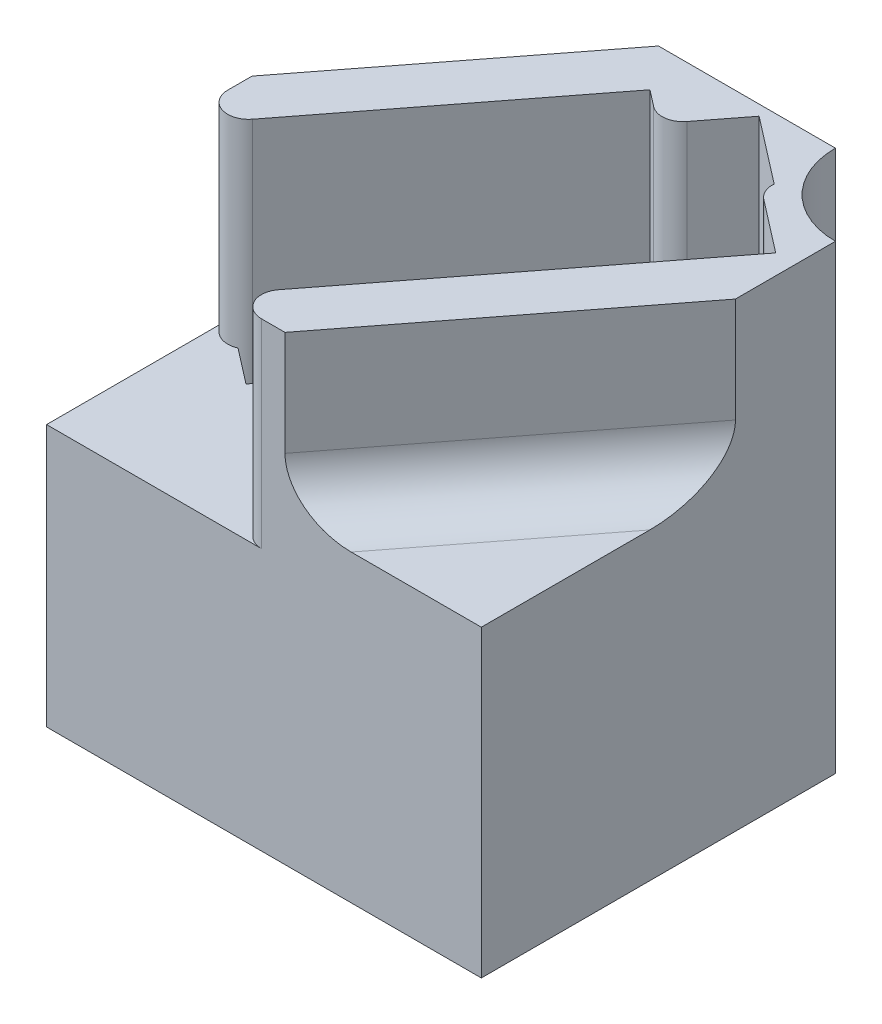
from build123d import *

# Parameters (mm, degrees)
BOSS_EXTRUDE1_DEPTH = 44
CUT_EXTRUDE1_DEPTH  = 19
CUT_EXTRUDE2_DEPTH  = 22
CUT_EXTRUDE3_DEPTH  = 19
CUT_EXTRUDE4_DEPTH  = 19
CUT_EXTRUDE5_DEPTH  = 15
FILLET1_R           = 2
FILLET2_R           = 5


with BuildPart() as part:
    # Sketch1 → Boss-Extrude1 (new body)
    with BuildSketch(Plane(origin=(0, 0, 0), x_dir=(1, 0, 0), z_dir=(0, 1, 0))):
        with BuildLine():
            Line((33.8, 41.5), (0, 41.5))
            Line((0, 41.5), (0, 0))
            Line((0, 0), (41.5, 0))
            Line((41.5, 0), (41.5, 33.8))
            ThreePointArc((41.5, 33.8), (36.055277785, 36.055277785), (33.8, 41.5))
        make_face()
    extrude(amount=BOSS_EXTRUDE1_DEPTH)

    # Sketch2 → Cut-Extrude1 (cut)
    with BuildSketch(Plane(origin=(0, 44, 0), x_dir=(1, 0, 0), z_dir=(0, 1, 0))):
        Polygon((6.330417381, 0), (0, 0), (0, 4.89140223), (27.514137546, 40.5), (33.844554927, 35.60859777), align=None)
    extrude(amount=-CUT_EXTRUDE1_DEPTH, mode=Mode.SUBTRACT)

    # Sketch3 → Cut-Extrude2 (cut)
    with BuildSketch(Plane(origin=(0, 44, 0), x_dir=(1, 0, 0), z_dir=(0, 1, 0))):
        Polygon((6.165208691, 12.870370718), (23.285116497, 35.026831552), (20.119907806, 37.472532667), (3, 15.316071833), align=None)
    extrude(amount=-CUT_EXTRUDE2_DEPTH, mode=Mode.SUBTRACT)

    # Sketch5 → Cut-Extrude3 (cut)
    with BuildSketch(Plane(origin=(0, 44, 0), x_dir=(1, 0, 0), z_dir=(0, 1, 0))):
        Polygon((11.268941532, 6.39140223), (33.280251569, 34.878280446), (39.61066895, 29.986878216), (17.599358914, 1.5), align=None)
    extrude(amount=-CUT_EXTRUDE3_DEPTH, mode=Mode.SUBTRACT)

    # Sketch6 → Cut-Extrude4 (cut)
    with BuildSketch(Plane(origin=(0, 44, 0), x_dir=(1, 0, 0), z_dir=(0, 1, 0))):
        Polygon((17.599358914, 1.5), (16.440335282, 0), (0, 0), (0, 11.433493535), (3, 15.316071833), (6.165208691, 12.870370718), (11.268941532, 6.39140223), align=None)
    extrude(amount=-CUT_EXTRUDE4_DEPTH, mode=Mode.SUBTRACT)

    # Sketch7 → Cut-Extrude5 (cut)
    with BuildSketch(Plane(origin=(0, 44, 0), x_dir=(1, 0, 0), z_dir=(0, 1, 0))):
        Polygon((22.759033969, 0), (41.5, 24.254422662), (41.5, 0), align=None)
        Polygon((0, 19.611107666), (16.913162329, 41.5), (0, 41.5), align=None)
    extrude(amount=-CUT_EXTRUDE5_DEPTH, mode=Mode.SUBTRACT)

    # Fillet1
    # the kernel refuses this fillet: 2 mm, written as the material it takes off along each edge
    with BuildSketch(Plane(origin=(33.280251569, 48.213017341, -34.878280446), x_dir=(0.7913021726593984, 0, 0.6114252787908885), z_dir=(0, -1, 0))) as fillet1_piece_1:
        with BuildLine():
            CenterArc((1.685206936, -2), FILLET1_R, 90, 57.416069246)
            Line((0, -0.922931023), (0, 0))
            Line((0, 0), (1.685206936, 0))
        make_face()
    extrude(amount=23.213017341, mode=Mode.SUBTRACT)
    with BuildSketch(Plane(origin=(23.285116497, 49, -35.026831552), x_dir=(0.6114252787908897, 0, -0.7913021726593975), z_dir=(0, -1, 0))) as fillet1_piece_2:
        with BuildLine():
            CenterArc((FILLET1_R, -FILLET1_R), FILLET1_R, 90, 90)
            Line((0, -FILLET1_R), (0, 0))
            Line((0, 0), (FILLET1_R, 0))
        make_face()
    extrude(amount=24, mode=Mode.SUBTRACT)
    with BuildSketch(Plane(origin=(16.440335282, 54.182110795, 0), x_dir=(1, 0, 0), z_dir=(0, -1, 0))) as fillet1_piece_3:
        with BuildLine():
            CenterArc((FILLET1_R * 2.0364221589, -FILLET1_R), FILLET1_R, 90, 127.692631401)
            Line((FILLET1_R * 1.24511998624, -FILLET1_R * 1.61142527879), (0, 0))
            Line((0, 0), (FILLET1_R * 2.0364221589, 0))
        make_face()
    extrude(amount=29.182110795, mode=Mode.SUBTRACT)
    with BuildSketch(Plane(origin=(0, 58.64857796, -11.433493535), x_dir=(0, 0, -1), z_dir=(0, -1, 0))) as fillet1_piece_4:
        with BuildLine():
            CenterArc((FILLET1_R * 2.92971559207, FILLET1_R), FILLET1_R, 127.692631401, 142.307368599)
            Line((FILLET1_R * 2.31829031328, FILLET1_R * 1.79130217266), (0, 0))
            Line((0, 0), (FILLET1_R * 2.92971559207, 0))
        make_face()
    extrude(amount=33.64857796, mode=Mode.SUBTRACT)
    with BuildSketch(Plane(origin=(0, 58.64857796, -11.433493535), x_dir=(0, 0, -1), z_dir=(0, -1, 0))) as fillet1_piece_5_section:
        with BuildLine():
            CenterArc((FILLET1_R * 2.92971559207, FILLET1_R), FILLET1_R, 127.692631401, 142.307368599)
            Line((FILLET1_R * 2.31829031328, FILLET1_R * 1.79130217266), (0, 0))
            Line((0, 0), (FILLET1_R * 2.92971559207, 0))
        make_face()
    fillet1_piece_5 = extrude(amount=48.297155921, mode=Mode.PRIVATE)
    fillet1_piece_5 = split(fillet1_piece_5, bisect_by=Plane(origin=(2.943298817, 23.5, -15.35988384), z_dir=(0.6114252787908899, 0, -0.7913021726593973)), keep=Keep.TOP, mode=Mode.PRIVATE)
    fillet1_piece_5 = split(fillet1_piece_5, bisect_by=Plane(origin=(3.087132223, 22, -15.546031994), z_dir=(0, 1, 0)), keep=Keep.TOP, mode=Mode.PRIVATE)
    add(fillet1_piece_5, mode=Mode.SUBTRACT)

    # Fillet2
    fillet2_edges = [part.edges().sort_by_distance(p)[0] for p in [
        (32.129516985, 29, -12.127211331),
        (8.456581164, 29, -30.555553833),
    ]]
    fillet(fillet2_edges, radius=FILLET2_R)


solid = part.part
